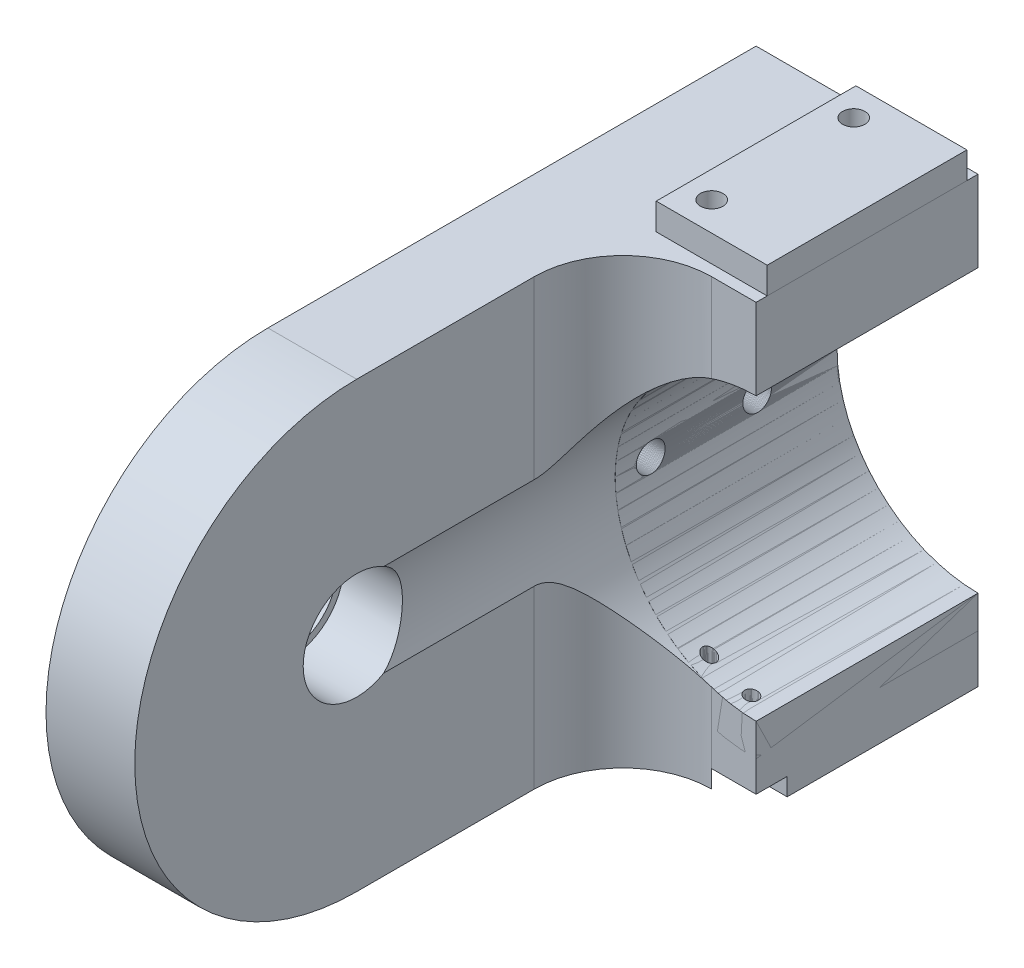
from build123d import *

# Parameters (mm, degrees)
CENTRE_HOLE_FOR_L2_DEPTH      = 40
CENTRE_HOLE_FOR_L2_DEPTH_BACK = 10
SKETCH1_R                     = 39.1
SKETCH1_R_2                   = 31.75
MAIN_STRUCTURE_DEPTH          = 60
MAIN_STRUCTURE_DEPTH_BACK     = 50
SKETCH2_W                     = 100
SKETCH2_H                     = 100
SKETCH2_R                     = 31.75
BEARING_CURVE_DEPTH           = 20
SHAFT_HOLE_REACH              = 189.083
SKETCH6_R                     = 10.5
WRIST_CUTOUT_DEPTH            = 188.082869365
SKETCH9_R                     = 12.05
BEARING_DEPTH                 = 15
SURFACECUT1_DEPTH             = 50
SKETCH11_W                    = 25
SKETCH11_H                    = 45
SKETCH11_R                    = 2.525
BOSS_EXTRUDE1_DEPTH           = 6
SKETCH15_W                    = 19.8
SKETCH15_H                    = 7
CUT_EXTRUDE4_DEPTH            = 4
CUT_EXTRUDE5_REACH            = 190.16
CUT_EXTRUDE5_END_RADIUS       = 31.75
SKETCH16_R                    = 1.5
CUT_EXTRUDE6_DEPTH            = 168.7378908
CUT_EXTRUDE6_DEPTH_BACK       = 168.7378908
SKETCH18_R                    = 3.25


# Read off the part's stored shape, not the designer's step: SurfaceCut1
with BuildPart() as part:
    # Sketch1 → Centre Hole for L2 (new, two sides: drawn at the far end of the back side and taken through both)
    with BuildSketch(Plane.XY.offset(-CENTRE_HOLE_FOR_L2_DEPTH_BACK)):
        Circle(SKETCH1_R)
        Circle(SKETCH1_R_2, mode=Mode.SUBTRACT)
    extrude(amount=CENTRE_HOLE_FOR_L2_DEPTH + CENTRE_HOLE_FOR_L2_DEPTH_BACK)


with BuildPart() as body_2:
    # Sketch2 → Main Structure (new, two sides: drawn at the far end of the back side and taken through both)
    with BuildSketch(Plane.XY.offset(40).offset(-MAIN_STRUCTURE_DEPTH_BACK)):
        Rectangle(SKETCH2_W, SKETCH2_H)
        Circle(SKETCH2_R, mode=Mode.SUBTRACT)
    extrude(amount=MAIN_STRUCTURE_DEPTH + MAIN_STRUCTURE_DEPTH_BACK)

    # Sketch3 → Bearing Curve (add)
    with BuildSketch(Plane.ZY.offset(50)):
        with BuildLine():
            Line((100, 50), (100, -50))
            ThreePointArc((100, -50), (150, 0), (100, 50))
        make_face()
    bearing_curve = extrude(amount=-BEARING_CURVE_DEPTH)

    # Upright Mirror: Bearing Curve across plane
    add(bearing_curve.mirror(Plane(origin=(0, 0, 0), x_dir=(0, 0, 1), z_dir=(1, 0, 0))))

    # Shaft Hole: up to this face of the body (flat: up to its plane)
    shaft_hole_end = Plane(body_2.part.faces().sort_by_distance((-30, 0, 121.220659079))[0])
    # Sketch6 → Shaft Hole (cut, up to the picked face)
    with BuildSketch(Plane.ZY.offset(50), mode=Mode.PRIVATE) as shaft_hole_sk1:
        with Locations((100, 0)):
            Circle(SKETCH6_R)
    shaft_hole_tool1 = split(extrude(shaft_hole_sk1.sketch, amount=-SHAFT_HOLE_REACH, mode=Mode.PRIVATE), bisect_by=shaft_hole_end, keep=Keep.BOTH, mode=Mode.PRIVATE)
    add(shaft_hole_tool1.solids().sort_by(Axis((-50, 0, 100), (1, 0, 0)))[0], mode=Mode.SUBTRACT)

    # Sketch4 → Wrist Cutout (cut, through all)
    with BuildSketch(Plane(origin=(0, 50, 0), x_dir=(1, 0, 0), z_dir=(0, 1, 0))):
        with BuildLine():
            Line((-30, -100), (-30, -60))
            ThreePointArc((-30, -60), (-24.142135624, -45.857864376), (-10, -40))
            Line((-10, -40), (10, -40))
            ThreePointArc((10, -40), (24.142135624, -45.857864376), (30, -60))
            Line((30, -60), (30, -100))
            Line((30, -100), (-30, -100))
        make_face()
    extrude(amount=-WRIST_CUTOUT_DEPTH, mode=Mode.SUBTRACT)

    # Sketch9 → Bearing (cut)
    with BuildSketch(Plane(origin=(-30, 0, 0), x_dir=(0, 0, -1), z_dir=(1, 0, 0))):
        with Locations(Location((-100, 0, 0), (0, 0, 59.619002111))):
            Circle(SKETCH9_R)
    extrude(amount=-BEARING_DEPTH, mode=Mode.SUBTRACT)


with BuildPart() as surfacecut1_tool:
    # SurfaceCut1 outline → SurfaceCut1 (new body)
    with BuildSketch(Plane.YZ):
        with BuildLine():
            ThreePointArc((50, 100), (0, 150), (-50, 100))
            Line((-50, 100), (-50, -10))
            Line((-50, -10), (50, -10))
            Line((50, -10), (50, 100))
        make_face()
    extrude(amount=SURFACECUT1_DEPTH)


with BuildPart() as part_1:
    add(part.part)

    # SurfaceCut1: cut by surfacecut1_tool
    add(surfacecut1_tool.part, mode=Mode.SUBTRACT)


with BuildPart() as body_2_1:
    add(body_2.part)

    # SurfaceCut1: cut by surfacecut1_tool
    add(surfacecut1_tool.part, mode=Mode.SUBTRACT)

    # Sketch15 → Cut-Extrude4 (cut)
    with BuildSketch(Plane(origin=(0, -50, 0), x_dir=(-1, 0, 0), z_dir=(0, -1, 0))):
        with Locations((9.9, -36.5)):
            Rectangle(SKETCH15_W, SKETCH15_H)
    extrude(amount=-CUT_EXTRUDE4_DEPTH, mode=Mode.SUBTRACT)


with BuildPart() as body_3:
    # Sketch11 → Boss-Extrude1 (new body)
    with BuildSketch(Plane(origin=(0, 50, 0), x_dir=(1, 0, 0), z_dir=(0, 1, 0))):
        with Locations((-12.5, -15)):
            Rectangle(SKETCH11_W, SKETCH11_H)
        with Locations(Location((-19, 1, 0), (0, 0, 270))):
            Circle(SKETCH11_R, mode=Mode.SUBTRACT)
        with Locations(Location((-19, -31, 0), (0, 0, 270))):
            Circle(SKETCH11_R, mode=Mode.SUBTRACT)
    extrude(amount=BOSS_EXTRUDE1_DEPTH)


with BuildPart() as cut_extrude5_tool:
    # Cut-Extrude5: up to this cylinder (the profile starts outside it)
    cut_extrude5_end = Plane(origin=(0, 0, 35.9), z_dir=(0, 0, 1)) * Cylinder(CUT_EXTRUDE5_END_RADIUS, 444.82, mode=Mode.PRIVATE)
    # Sketch16 → Cut-Extrude5 (new, up to the surface)
    with BuildSketch(Plane(origin=(0, -46, 0), x_dir=(-1, 0, 0), z_dir=(0, -1, 0)), mode=Mode.PRIVATE) as cut_extrude5_sk1:
        with Locations(Location((14.65, -35.9, 0), (0, 0, 90))):
            Circle(SKETCH16_R)
    cut_extrude5_tool1 = extrude(cut_extrude5_sk1.sketch, amount=-CUT_EXTRUDE5_REACH, mode=Mode.PRIVATE) - cut_extrude5_end
    add(cut_extrude5_tool1.solids().sort_by_distance((-14.65, -46, 35.9))[0])
    # Sketch16 → Cut-Extrude5 (new, up to the surface)
    with BuildSketch(Plane(origin=(0, -46, 0), x_dir=(-1, 0, 0), z_dir=(0, -1, 0)), mode=Mode.PRIVATE) as cut_extrude5_sk2:
        with Locations(Location((5.15, -35.9, 0), (0, 0, 90))):
            Circle(SKETCH16_R)
    cut_extrude5_tool2 = extrude(cut_extrude5_sk2.sketch, amount=-CUT_EXTRUDE5_REACH, mode=Mode.PRIVATE) - cut_extrude5_end
    add(cut_extrude5_tool2.solids().sort_by_distance((-5.15, -46, 35.9))[0])


with BuildPart() as part_2:
    add(part_1.part)

    # Cut-Extrude5: cut by cut_extrude5_tool
    add(cut_extrude5_tool.part, mode=Mode.SUBTRACT)


with BuildPart() as body_2_2:
    add(body_2_1.part)

    # Cut-Extrude5: cut by cut_extrude5_tool
    add(cut_extrude5_tool.part, mode=Mode.SUBTRACT)


with BuildPart() as cut_extrude6_tool:
    # Sketch18 → Cut-Extrude6 (new, two sides: drawn at the far end of the back side and taken through both)
    with BuildSketch(Plane.ZY.offset(50).offset(-CUT_EXTRUDE6_DEPTH_BACK)):
        with Locations((8, 0)):
            Circle(SKETCH18_R)
        with Locations((32, 0)):
            Circle(SKETCH18_R)
    extrude(amount=CUT_EXTRUDE6_DEPTH + CUT_EXTRUDE6_DEPTH_BACK)


with BuildPart() as part_3:
    add(part_2.part)

    # Cut-Extrude6: cut by cut_extrude6_tool
    add(cut_extrude6_tool.part, mode=Mode.SUBTRACT)


with BuildPart() as body_2_3:
    add(body_2_2.part)

    # Cut-Extrude6: cut by cut_extrude6_tool
    add(cut_extrude6_tool.part, mode=Mode.SUBTRACT)


solid = Compound([body_3.part, part_3.part, body_2_3.part])
